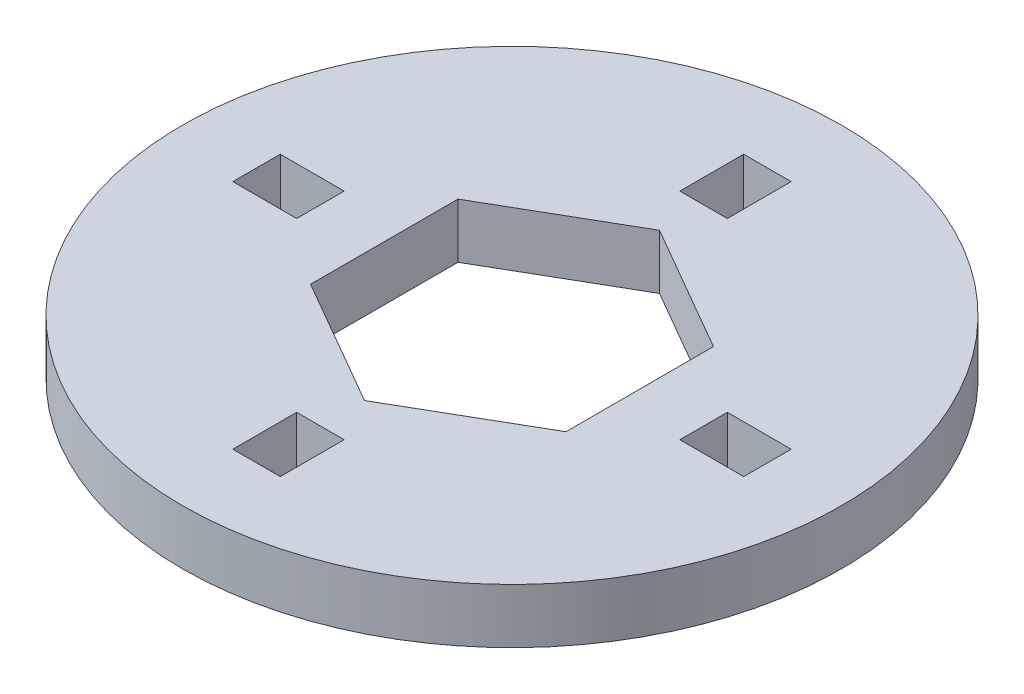
from build123d import *

# Parameters (mm, degrees)
SKETCH1_R           = 18.062391868
SKETCH1_W           = 3.5
SKETCH1_H           = 2.6
SKETCH1_W_2         = 2.6
SKETCH1_H_2         = 3.5
BOSS_EXTRUDE1_DEPTH = 3


with BuildPart() as part:
    # Sketch1 → Boss-Extrude1 (new body)
    with BuildSketch(Plane(origin=(0, 0, 0), x_dir=(1, 0, 0), z_dir=(0, 1, 0))):
        Circle(SKETCH1_R)
        with Locations((-12.25, 0)):
            Rectangle(SKETCH1_W, SKETCH1_H, mode=Mode.SUBTRACT)
        with Locations((0, -12.25)):
            Rectangle(SKETCH1_W_2, SKETCH1_H_2, mode=Mode.SUBTRACT)
        with Locations((0, 12.25)):
            Rectangle(SKETCH1_W_2, SKETCH1_H_2, mode=Mode.SUBTRACT)
        with Locations((12.25, 0)):
            Rectangle(SKETCH1_W, SKETCH1_H, mode=Mode.SUBTRACT)
        Polygon((0, -8.082903769), (7, -4.041451884), (7, 4.041451884), (0, 8.082903769), (-7, 4.041451884), (-7, -4.041451884), align=None, mode=Mode.SUBTRACT)
    extrude(amount=BOSS_EXTRUDE1_DEPTH)


solid = part.part
